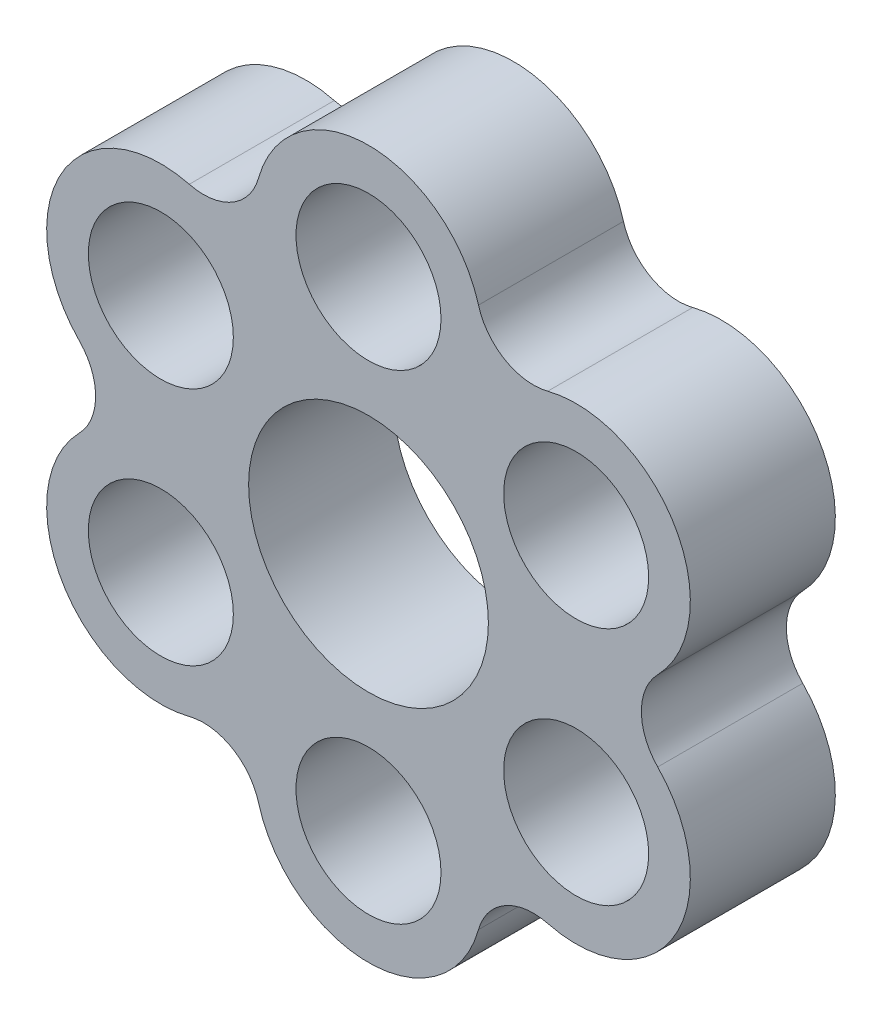
from build123d import *

# Parameters (mm, degrees)
SKETCH1_R           = 10.5
SKETCH1_R_2         = 6.35
BOSS_EXTRUDE1_DEPTH = 6.35


with BuildPart() as part:
    # Sketch1 → Boss-Extrude1 (new, symmetric)
    with BuildSketch(Plane.XY):
        with BuildLine():
            ThreePointArc((9.632892041, 23.684658438), (0, 31), (-9.632892041, 23.684658438))
            ThreePointArc((-9.632892041, 23.684658438), (-11.949338061, 20.696860639), (-15.695069867, 20.184658438))
            ThreePointArc((-15.695069867, 20.184658438), (-26.846787517, 15.5), (-25.327961908, 3.5))
            ThreePointArc((-25.327961908, 3.5), (-23.898676122, 0), (-25.327961908, -3.5))
            ThreePointArc((-25.327961908, -3.5), (-26.846787517, -15.5), (-15.695069867, -20.184658438))
            ThreePointArc((-15.695069867, -20.184658438), (-11.949338061, -20.696860639), (-9.632892041, -23.684658438))
            ThreePointArc((-9.632892041, -23.684658438), (0, -31), (9.632892041, -23.684658438))
            ThreePointArc((9.632892041, -23.684658438), (11.949338061, -20.696860639), (15.695069867, -20.184658438))
            ThreePointArc((15.695069867, -20.184658438), (26.846787517, -15.5), (25.327961908, -3.5))
            ThreePointArc((25.327961908, -3.5), (23.898676122, 0), (25.327961908, 3.5))
            ThreePointArc((25.327961908, 3.5), (26.846787517, 15.5), (15.695069867, 20.184658438))
            ThreePointArc((15.695069867, 20.184658438), (11.949338061, 20.696860639), (9.632892041, 23.684658438))
        make_face()
        Circle(SKETCH1_R, mode=Mode.SUBTRACT)
        with Locations((0, 21)):
            Circle(SKETCH1_R_2, mode=Mode.SUBTRACT)
        with Locations((18.186533479, 10.5)):
            Circle(SKETCH1_R_2, mode=Mode.SUBTRACT)
        with Locations((18.186533479, -10.5)):
            Circle(SKETCH1_R_2, mode=Mode.SUBTRACT)
        with Locations((0, -21)):
            Circle(SKETCH1_R_2, mode=Mode.SUBTRACT)
        with Locations((-18.186533479, -10.5)):
            Circle(SKETCH1_R_2, mode=Mode.SUBTRACT)
        with Locations((-18.186533479, 10.5)):
            Circle(SKETCH1_R_2, mode=Mode.SUBTRACT)
    extrude(amount=BOSS_EXTRUDE1_DEPTH, both=True)


solid = part.part
